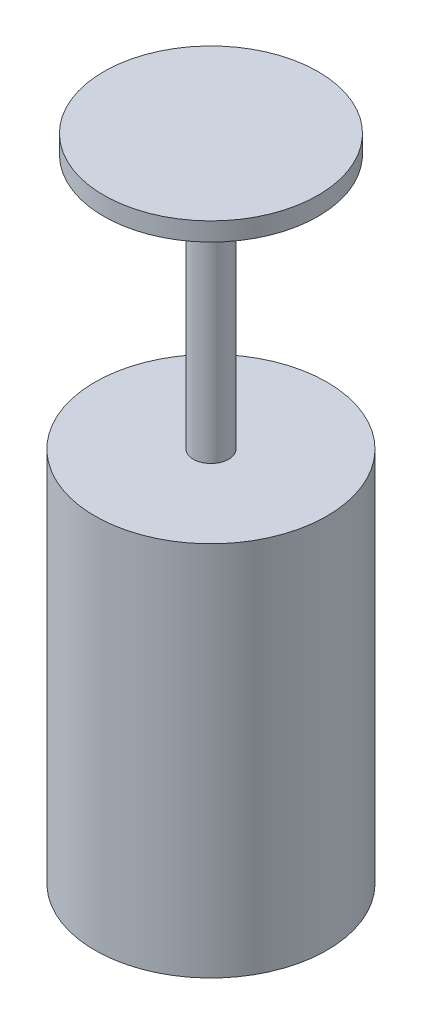
from build123d import *


with BuildPart() as part:
    # Sketch1 → Revolve1 (revolve)
    with BuildSketch(Plane.XY):
        Polygon((0, -52.07), (16.0655, -52.07), (16.0655, 0), (2.450561434, 0), (2.450561434, 35.306), (14.836359841, 35.306), (14.836359841, 37.846), (0, 37.846), align=None)
    revolve(axis=Axis((0, 0, 0), (0, 1, 0)))


solid = part.part
